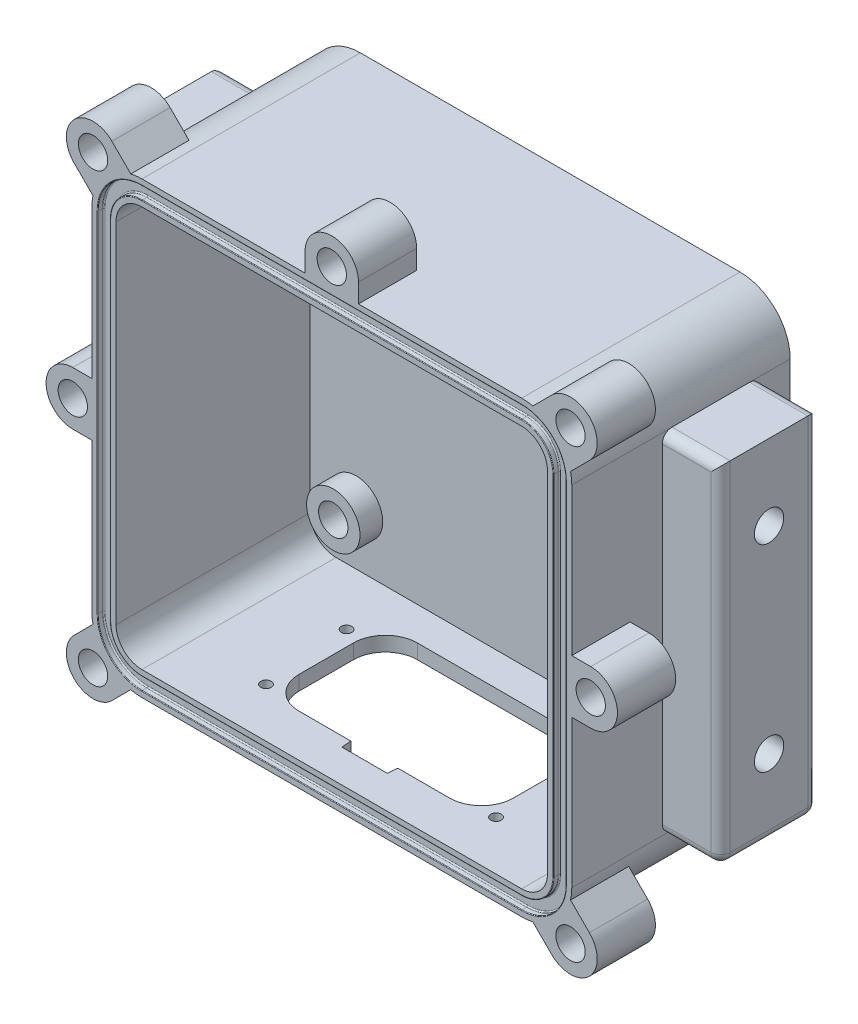
from build123d import *

# Parameters (mm, degrees)
BOSS_EXTRUDE1_DEPTH     = 40
SHELL1_T                = 5
CUT_EXTRUDE4_DEPTH      = 1.2446
FILLET1_R               = 0.254
FILLET2_R               = 0.127
BOSS_EXTRUDE7_START     = -12
BOSS_EXTRUDE7_DEPTH     = 12
SKETCH17_R              = 3.025
CUT_EXTRUDE5_DEPTH      = 9
MIRROR3_START           = -12
MIRROR3_COPY_1_DEPTH    = 12
MIRROR3_COPY_2_SKETCH_R = 3.025
MIRROR3_COPY_2_DEPTH    = 9
BOSS_EXTRUDE9_DEPTH     = 12
SKETCH22_W              = 20
SKETCH22_H              = 71.882
BOSS_EXTRUDE10_DEPTH    = 12
SKETCH23_R              = 3.025
CUT_EXTRUDE8_DEPTH      = 8
SKETCH21_R              = 3.025
CUT_EXTRUDE9_DEPTH      = 9
FILLET3_R               = 2
SKETCH27_R              = 5.5
SKETCH27_R_2            = 3.025
BOSS_EXTRUDE12_DEPTH    = 4.69
SKETCH28_R              = 1.085
CUT_EXTRUDE12_DEPTH     = 5
CUT_EXTRUDE13_DEPTH     = 2
BOSS_EXTRUDE13_DEPTH    = 12
SKETCH31_R              = 3.025
CUT_EXTRUDE14_DEPTH     = 9
SKETCH33_R              = 3.025
CUT_EXTRUDE15_DEPTH     = 5


with BuildPart() as part:
    # Sketch2 → Boss-Extrude1 (new body)
    with BuildSketch(Plane.XY):
        with BuildLine():
            Line((14.477997498, 136.398000793), (92.709997498, 136.398000793))
            ThreePointArc((92.709997498, 136.398000793), (96.481705068, 134.835708364), (98.043997498, 131.064000793))
            Line((98.043997498, 131.064000793), (98.043997498, 59.182000793))
            ThreePointArc((98.043997498, 59.182000793), (96.481705068, 55.410293223), (92.709997498, 53.848000793))
            Line((92.709997498, 53.848000793), (14.477997498, 53.848000793))
            ThreePointArc((14.477997498, 53.848000793), (10.706289927, 55.410293223), (9.143997498, 59.182000793))
            Line((9.143997498, 59.182000793), (9.143997498, 131.064000793))
            ThreePointArc((9.143997498, 131.064000793), (10.706289927, 134.835708364), (14.477997498, 136.398000793))
        make_face()
    extrude(amount=BOSS_EXTRUDE1_DEPTH)

    # Shell1
    shell1_openings = [part.faces().sort_by_distance(p)[0] for p in [
        (53.593997498, 95.123000793, 40),
    ]]
    offset(amount=SHELL1_T, openings=shell1_openings, kind=Kind.INTERSECTION)

    # Sketch15 → Cut-Extrude4 (cut)
    with BuildSketch(Plane.XY.offset(40)):
        with BuildLine():
            Line((92.709997498, 140.180700793), (14.477997498, 140.180700793))
            ThreePointArc((14.477997498, 140.180700793), (8.031517106, 137.510481186), (5.361297498, 131.064000793))
            Line((5.361297498, 131.064000793), (5.361297498, 59.182000793))
            ThreePointArc((5.361297498, 59.182000793), (8.031517106, 52.735520401), (14.477997498, 50.065300793))
            Line((14.477997498, 50.065300793), (92.709997498, 50.065300793))
            ThreePointArc((92.709997498, 50.065300793), (99.15647789, 52.735520401), (101.826697498, 59.182000793))
            Line((101.826697498, 59.182000793), (101.826697498, 131.064000793))
            ThreePointArc((101.826697498, 131.064000793), (99.15647789, 137.510481186), (92.709997498, 140.180700793))
        make_face()
        with BuildLine():
            Line((7.926697498, 131.064000793), (7.926697498, 59.182000793))
            ThreePointArc((7.926697498, 59.182000793), (9.845528842, 54.549532138), (14.477997498, 52.630700793))
            Line((14.477997498, 52.630700793), (92.709997498, 52.630700793))
            ThreePointArc((92.709997498, 52.630700793), (97.342466153, 54.549532138), (99.261297498, 59.182000793))
            Line((99.261297498, 59.182000793), (99.261297498, 131.064000793))
            ThreePointArc((99.261297498, 131.064000793), (97.342466153, 135.696469449), (92.709997498, 137.615300793))
            Line((92.709997498, 137.615300793), (14.477997498, 137.615300793))
            ThreePointArc((14.477997498, 137.615300793), (9.845528842, 135.696469449), (7.926697498, 131.064000793))
        make_face(mode=Mode.SUBTRACT)
    extrude(amount=-CUT_EXTRUDE4_DEPTH, mode=Mode.SUBTRACT)

    # Fillet1
    fillet1_edges = [part.edges().sort_by_distance(p)[0] for p in [
        (97.342466153, 54.549532138, 38.7554),
        (53.593997498, 52.630700793, 38.7554),
        (9.845528842, 54.549532138, 38.7554),
        (7.926697498, 95.123000793, 38.7554),
        (9.845528842, 135.696469449, 38.7554),
        (53.593997498, 137.615300793, 38.7554),
        (97.342466153, 135.696469449, 38.7554),
        (99.15647789, 52.735520401, 38.7554),
        (53.593997498, 50.065300793, 38.7554),
        (8.031517106, 52.735520401, 38.7554),
        (5.361297498, 95.123000793, 38.7554),
        (8.031517106, 137.510481186, 38.7554),
        (53.593997498, 140.180700793, 38.7554),
        (99.15647789, 137.510481186, 38.7554),
        (99.261297498, 95.123000793, 38.7554),
        (101.826697498, 95.123000793, 38.7554),
    ]]
    fillet(fillet1_edges, radius=FILLET1_R)

    # Fillet2
    fillet2_edges = [part.edges().sort_by_distance(p)[0] for p in [
        (99.15647789, 52.735520401, 40),
        (53.593997498, 50.065300793, 40),
        (8.031517106, 52.735520401, 40),
        (5.361297498, 95.123000793, 40),
        (8.031517106, 137.510481186, 40),
        (53.593997498, 140.180700793, 40),
        (99.15647789, 137.510481186, 40),
        (97.342466153, 54.549532138, 40),
        (53.593997498, 52.630700793, 40),
        (9.845528842, 54.549532138, 40),
        (7.926697498, 95.123000793, 40),
        (9.845528842, 135.696469449, 40),
        (53.593997498, 137.615300793, 40),
        (97.342466153, 135.696469449, 40),
        (101.826697498, 95.123000793, 40),
        (99.261297498, 95.123000793, 40),
    ]]
    fillet(fillet2_edges, radius=FILLET2_R)

    # Sketch16 → Boss-Extrude7 (add)
    with BuildSketch(Plane.XY.offset(40).offset(BOSS_EXTRUDE7_START)):
        with BuildLine():
            ThreePointArc((100.414641888, 54.074707527), (99.246280451, 52.64571784), (97.817290764, 51.477356403))
            ThreePointArc((97.817290764, 51.477356403), (97.525442321, 50.728996161), (97.345709873, 49.9461074))
            ThreePointArc((97.345709873, 49.9461074), (96.201801868, 49.455806356), (95.007248213, 49.106575485))
            Line((95.007248213, 49.106575485), (98.89272706, 45.221096638))
            ThreePointArc((98.89272706, 45.221096638), (106.670901653, 45.221096638), (106.670901653, 52.999271231))
            Line((106.670901653, 52.999271231), (102.785422806, 56.884750078))
            ThreePointArc((102.785422806, 56.884750078), (102.436191935, 55.690196423), (101.945890891, 54.546288418))
            ThreePointArc((101.945890891, 54.546288418), (101.16300213, 54.36655597), (100.414641888, 54.074707527))
        make_face()
    boss_extrude7 = extrude(amount=BOSS_EXTRUDE7_DEPTH)

    # Sketch17 → Cut-Extrude5 (cut)
    with BuildSketch(Plane.XY.offset(40)):
        with Locations((102.781814357, 49.110183934)):
            Circle(SKETCH17_R)
    cut_extrude5 = extrude(amount=-CUT_EXTRUDE5_DEPTH, mode=Mode.SUBTRACT)

    # Mirror2: Boss-Extrude7, Cut-Extrude5 across plane
    add(boss_extrude7.mirror(Plane(origin=(0, 95.123000793, 0), x_dir=(0, 0, 1), z_dir=(0, -1, 0))))
    add(cut_extrude5.mirror(Plane(origin=(0, 95.123000793, 0), x_dir=(0, 0, 1), z_dir=(0, -1, 0))), mode=Mode.SUBTRACT)

    # Mirror3: Boss-Extrude7, Cut-Extrude5 across plane
    add(boss_extrude7.mirror(Plane(origin=(53.593997498, 0, 0), x_dir=(0, 0, 1), z_dir=(1, 0, 0))))
    add(cut_extrude5.mirror(Plane(origin=(53.593997498, 0, 0), x_dir=(0, 0, 1), z_dir=(1, 0, 0))), mode=Mode.SUBTRACT)

    # Mirror3 copy 1 sketch → Mirror3 copy 1 (add)
    with BuildSketch(Plane(origin=(107.187994995, 190.246001587, 40), x_dir=(-1, 0, 0), z_dir=(0, 0, 1)).offset(MIRROR3_START)):
        with BuildLine():
            ThreePointArc((100.414641888, 54.074707527), (99.246280451, 52.64571784), (97.817290764, 51.477356403))
            ThreePointArc((97.817290764, 51.477356403), (97.525442321, 50.728996161), (97.345709873, 49.9461074))
            ThreePointArc((97.345709873, 49.9461074), (96.201801868, 49.455806356), (95.007248213, 49.106575485))
            Line((95.007248213, 49.106575485), (98.89272706, 45.221096638))
            ThreePointArc((98.89272706, 45.221096638), (106.670901653, 45.221096638), (106.670901653, 52.999271231))
            Line((106.670901653, 52.999271231), (102.785422806, 56.884750078))
            ThreePointArc((102.785422806, 56.884750078), (102.436191935, 55.690196423), (101.945890891, 54.546288418))
            ThreePointArc((101.945890891, 54.546288418), (101.16300213, 54.36655597), (100.414641888, 54.074707527))
        make_face()
    extrude(amount=MIRROR3_COPY_1_DEPTH)

    # Mirror3 copy 2 sketch → Mirror3 copy 2 (cut)
    with BuildSketch(Plane(origin=(107.187994995, 190.246001587, 40), x_dir=(-1, 0, 0), z_dir=(0, 0, 1))):
        with Locations((102.781814357, 49.110183934)):
            Circle(MIRROR3_COPY_2_SKETCH_R)
    extrude(amount=-MIRROR3_COPY_2_DEPTH, mode=Mode.SUBTRACT)

    # Sketch20 → Boss-Extrude9 (add)
    with BuildSketch(Plane.XY.offset(40)):
        with BuildLine():
            ThreePointArc((103.043997498, 98.991365553), (102.42959743, 98.250702598), (101.953697498, 97.414288641))
            Line((101.953697498, 97.414288641), (101.953697498, 92.831712946))
            ThreePointArc((101.953697498, 92.831712946), (102.42959743, 91.995298988), (103.043997498, 91.254636034))
            Line((103.043997498, 91.254636034), (103.043997498, 89.623000793))
            Line((103.043997498, 89.623000793), (106.953697498, 89.623000793))
            ThreePointArc((106.953697498, 89.623000793), (112.453697498, 95.123000793), (106.953697498, 100.623000793))
            Line((106.953697498, 100.623000793), (103.043997498, 100.623000793))
            Line((103.043997498, 100.623000793), (103.043997498, 98.991365553))
        make_face()
    boss_extrude9 = extrude(amount=-BOSS_EXTRUDE9_DEPTH)

    # Mirror5: Boss-Extrude9 across plane
    add(boss_extrude9.mirror(Plane(origin=(53.593997498, 0, 0), x_dir=(0, 0, 1), z_dir=(1, 0, 0))))

    # Sketch22 → Boss-Extrude10 (add)
    with BuildSketch(Plane.ZY.offset(-4.143997498)):
        with Locations((11.35, 95.123000793)):
            Rectangle(SKETCH22_W, SKETCH22_H)
    boss_extrude10 = extrude(amount=BOSS_EXTRUDE10_DEPTH)

    # Sketch23 → Cut-Extrude8 (cut)
    with BuildSketch(Plane.ZY.offset(7.856002502)):
        with Locations((11.35, 74.803000793)):
            Circle(SKETCH23_R)
        with Locations((11.35, 115.443000793)):
            Circle(SKETCH23_R)
    cut_extrude8 = extrude(amount=-CUT_EXTRUDE8_DEPTH, mode=Mode.SUBTRACT)

    # Sketch21 → Cut-Extrude9 (cut)
    with BuildSketch(Plane.XY.offset(40)):
        with Locations((0.234297498, 95.123000793)):
            Circle(SKETCH21_R)
    cut_extrude9 = extrude(amount=-CUT_EXTRUDE9_DEPTH, mode=Mode.SUBTRACT)

    # Mirror7: Boss-Extrude10, Cut-Extrude8, Cut-Extrude9 across plane
    add(boss_extrude10.mirror(Plane(origin=(53.593997498, 0, 0), x_dir=(0, 0, 1), z_dir=(1, 0, 0))))
    add(cut_extrude8.mirror(Plane(origin=(53.593997498, 0, 0), x_dir=(0, 0, 1), z_dir=(1, 0, 0))), mode=Mode.SUBTRACT)
    add(cut_extrude9.mirror(Plane(origin=(53.593997498, 0, 0), x_dir=(0, 0, 1), z_dir=(1, 0, 0))), mode=Mode.SUBTRACT)

    # Fillet3
    fillet3_edges = [part.edges().sort_by_distance(p)[0] for p in [
        (109.043997498, 59.182000793, 21.35),
        (109.043997498, 131.064000793, 21.35),
        (115.043997498, 95.123000793, 21.35),
        (-1.856002502, 131.064000793, 21.35),
        (-7.856002502, 95.123000793, 1.35),
        (-1.856002502, 59.182000793, 21.35),
        (-7.856002502, 95.123000793, 21.35),
        (-1.856002502, 131.064000793, 1.35),
        (109.043997498, 131.064000793, 1.35),
        (115.043997498, 59.182000793, 11.35),
        (109.043997498, 59.182000793, 1.35),
        (115.043997498, 95.123000793, 1.35),
        (-1.856002502, 59.182000793, 1.35),
        (-7.856002502, 59.182000793, 11.35),
    ]]
    fillet(fillet3_edges, radius=FILLET3_R)

    # Sketch27 → Boss-Extrude12 (add)
    # profile 1 of 4: a face of its own
    with BuildSketch(Plane.XY):
        with Locations((18.59401352, 114.997893016)):
            Circle(SKETCH27_R)
        with Locations((18.59401352, 114.997893016)):
            Circle(SKETCH27_R_2, mode=Mode.SUBTRACT)
    # profile 2 of 4: a face of its own
    with BuildSketch(Plane.XY):
        with Locations((88.59401352, 114.997880777)):
            Circle(SKETCH27_R)
        with Locations((88.59401352, 114.997880777)):
            Circle(SKETCH27_R_2, mode=Mode.SUBTRACT)
    # profile 3 of 4: a face of its own
    with BuildSketch(Plane.XY):
        with Locations((88.594004778, 64.997880777)):
            Circle(SKETCH27_R)
        with Locations((88.594004778, 64.997880777)):
            Circle(SKETCH27_R_2, mode=Mode.SUBTRACT)
    # profile 4 of 4: a face of its own
    with BuildSketch(Plane.XY):
        with Locations((18.594004778, 64.997893016)):
            Circle(SKETCH27_R)
        with Locations((18.594004778, 64.997893016)):
            Circle(SKETCH27_R_2, mode=Mode.SUBTRACT)
    extrude(amount=BOSS_EXTRUDE12_DEPTH)

    # Sketch28 → Cut-Extrude12 (cut)
    with BuildSketch(Plane.XZ.offset(-48.848000793)):
        with BuildLine():
            Line((58.268142348, 33.231), (48.919852647, 33.231))
            Line((48.919852647, 33.231), (48.74487532, 31.231))
            Line((48.74487532, 31.231), (38.093997498, 31.231))
            ThreePointArc((38.093997498, 31.231), (33.440527771, 29.303469727), (31.512997498, 24.65))
            Line((31.512997498, 24.65), (31.512997498, 13.45))
            ThreePointArc((31.512997498, 13.45), (33.440527771, 8.796530273), (38.093997498, 6.869))
            Line((38.093997498, 6.869), (69.093997498, 6.869))
            ThreePointArc((69.093997498, 6.869), (73.747467225, 8.796530273), (75.674997498, 13.45))
            Line((75.674997498, 13.45), (75.674997498, 24.65))
            ThreePointArc((75.674997498, 24.65), (73.747467225, 29.303469727), (69.093997498, 31.231))
            Line((69.093997498, 31.231), (58.443119675, 31.231))
            Line((58.443119675, 31.231), (58.268142348, 33.231))
        make_face()
        with Locations((77.293997498, 29.85)):
            Circle(SKETCH28_R)
        with Locations((28.393997498, 11.75)):
            Circle(SKETCH28_R)
        with Locations((78.793997498, 11.75)):
            Circle(SKETCH28_R)
        with Locations((29.893997498, 29.85)):
            Circle(SKETCH28_R)
    extrude(amount=-CUT_EXTRUDE12_DEPTH, mode=Mode.SUBTRACT)

    # Sketch29 → Cut-Extrude13 (cut)
    with BuildSketch(Plane.XZ.offset(-48.848000793)):
        with BuildLine():
            ThreePointArc((82.593997498, 28.55), (80.543744966, 33.499747468), (75.593997498, 35.55))
            Line((75.593997498, 35.55), (31.593997498, 35.55))
            ThreePointArc((31.593997498, 35.55), (26.644250029, 33.499747468), (24.593997498, 28.55))
            Line((24.593997498, 28.55), (24.593997498, 9.55))
            ThreePointArc((24.593997498, 9.55), (26.644250029, 4.600252532), (31.593997498, 2.55))
            Line((31.593997498, 2.55), (75.593997498, 2.55))
            ThreePointArc((75.593997498, 2.55), (80.543744966, 4.600252532), (82.593997498, 9.55))
            Line((82.593997498, 9.55), (82.593997498, 28.55))
        make_face()
        with BuildLine():
            ThreePointArc((27.308997498, 11.75), (28.393997498, 12.835), (29.478997498, 11.75))
            ThreePointArc((29.478997498, 11.75), (28.393997498, 10.665), (27.308997498, 11.75))
        make_face(mode=Mode.SUBTRACT)
        with BuildLine():
            ThreePointArc((77.708997498, 11.75), (78.793997498, 12.835), (79.878997498, 11.75))
            ThreePointArc((79.878997498, 11.75), (78.793997498, 10.665), (77.708997498, 11.75))
        make_face(mode=Mode.SUBTRACT)
        with BuildLine():
            ThreePointArc((31.512997498, 24.65), (33.440527771, 29.303469727), (38.093997498, 31.231))
            Line((38.093997498, 31.231), (48.74487532, 31.231))
            Line((48.74487532, 31.231), (48.919852647, 33.231))
            Line((48.919852647, 33.231), (51.068142348, 33.231))
            Line((51.068142348, 33.231), (56.119852647, 33.231))
            Line((56.119852647, 33.231), (58.268142348, 33.231))
            Line((58.268142348, 33.231), (58.443119675, 31.231))
            Line((58.443119675, 31.231), (69.093997498, 31.231))
            ThreePointArc((69.093997498, 31.231), (73.747467225, 29.303469727), (75.674997498, 24.65))
            Line((75.674997498, 24.65), (75.674997498, 13.45))
            ThreePointArc((75.674997498, 13.45), (73.747467225, 8.796530273), (69.093997498, 6.869))
            Line((69.093997498, 6.869), (38.093997498, 6.869))
            ThreePointArc((38.093997498, 6.869), (33.440527771, 8.796530273), (31.512997498, 13.45))
            Line((31.512997498, 13.45), (31.512997498, 24.65))
        make_face(mode=Mode.SUBTRACT)
        with BuildLine():
            ThreePointArc((28.808997498, 29.85), (29.893997498, 30.935), (30.978997498, 29.85))
            ThreePointArc((30.978997498, 29.85), (29.893997498, 28.765), (28.808997498, 29.85))
        make_face(mode=Mode.SUBTRACT)
        with BuildLine():
            ThreePointArc((76.208997498, 29.85), (77.293997498, 30.935), (78.378997498, 29.85))
            ThreePointArc((78.378997498, 29.85), (77.293997498, 28.765), (76.208997498, 29.85))
        make_face(mode=Mode.SUBTRACT)
    extrude(amount=-CUT_EXTRUDE13_DEPTH, mode=Mode.SUBTRACT)


with BuildPart() as cut_extrude13_kept_piece:
    # of the separate pieces the step leaves, the one the design keeps (cut_extrude13_pieces_kept)
    add(part.part.solids().sort_by_distance((103.043997498, 131.064000793, 3.35))[0])

    # Sketch30 → Boss-Extrude13 (add)
    with BuildSketch(Plane.XY.offset(40)):
        with BuildLine():
            ThreePointArc((59.093997498, 145.307700793), (53.593997498, 150.807700793), (48.093997498, 145.307700793))
            Line((48.093997498, 145.307700793), (48.093997498, 141.398000793))
            Line((48.093997498, 141.398000793), (49.725632738, 141.398000793))
            ThreePointArc((49.725632738, 141.398000793), (50.466295693, 140.783600726), (51.30270965, 140.307700793))
            Line((51.30270965, 140.307700793), (55.885285345, 140.307700793))
            ThreePointArc((55.885285345, 140.307700793), (56.721699303, 140.783600726), (57.462362257, 141.398000793))
            Line((57.462362257, 141.398000793), (59.093997498, 141.398000793))
            Line((59.093997498, 141.398000793), (59.093997498, 145.307700793))
        make_face()
    extrude(amount=-BOSS_EXTRUDE13_DEPTH)

    # Sketch31 → Cut-Extrude14 (cut)
    with BuildSketch(Plane.XY.offset(40)):
        with Locations((53.593997498, 145.307700793)):
            Circle(SKETCH31_R)
    extrude(amount=-CUT_EXTRUDE14_DEPTH, mode=Mode.SUBTRACT)

    # Sketch33 → Cut-Extrude15 (cut)
    with BuildSketch(Plane.XY.offset(4.69)):
        with Locations((88.594004778, 64.997880777)):
            Circle(SKETCH33_R)
        with Locations((88.59401352, 114.997880777)):
            Circle(SKETCH33_R)
        with Locations((18.59401352, 114.997893016)):
            Circle(SKETCH33_R)
        with Locations((18.594004778, 64.997893016)):
            Circle(SKETCH33_R)
    extrude(amount=-CUT_EXTRUDE15_DEPTH, mode=Mode.SUBTRACT)


solid = cut_extrude13_kept_piece.part
